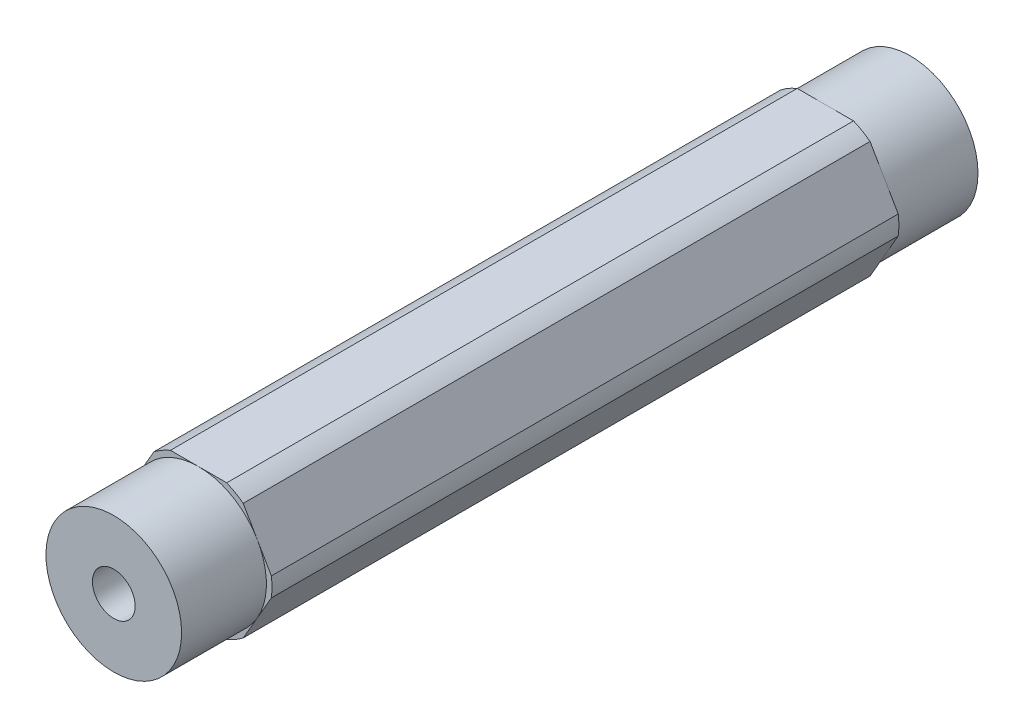
from build123d import *

# Parameters (mm, degrees)
SKETCH1_R           = 2.000000064
BOSS_EXTRUDE1_DEPTH = 29.34335
SKETCH4_R           = 6.35
SKETCH4_R_2         = 2.000000064
BOSS_EXTRUDE2_DEPTH = 7.9375


with BuildPart() as part:
    # Sketch1 → Boss-Extrude1 (new, symmetric)
    with BuildSketch(Plane.XY):
        with BuildLine():
            ThreePointArc((4.181770846, 5.456960429), (3.437499983, 5.953924622), (2.634980936, 6.35))
            Line((2.634980936, 6.35), (-2.634980936, 6.35))
            ThreePointArc((-2.634980936, 6.35), (-3.437499983, 5.953924622), (-4.181770846, 5.456960429))
            Line((-4.181770846, 5.456960429), (-6.816751782, 0.893039571))
            ThreePointArc((-6.816751782, 0.893039571), (-6.874999966, 0), (-6.816751782, -0.893039571))
            Line((-6.816751782, -0.893039571), (-4.181770846, -5.456960429))
            ThreePointArc((-4.181770846, -5.456960429), (-3.437499983, -5.953924622), (-2.634980936, -6.35))
            Line((-2.634980936, -6.35), (2.634980936, -6.35))
            ThreePointArc((2.634980936, -6.35), (3.437499983, -5.953924622), (4.181770846, -5.456960429))
            Line((4.181770846, -5.456960429), (6.816751782, -0.893039571))
            ThreePointArc((6.816751782, -0.893039571), (6.860422465, -0.447468582), (6.874999966, 0))
            ThreePointArc((6.874999966, 0), (6.860422465, 0.447468582), (6.816751782, 0.893039571))
            Line((6.816751782, 0.893039571), (4.181770846, 5.456960429))
        make_face()
        Circle(SKETCH1_R, mode=Mode.SUBTRACT)
    extrude(amount=BOSS_EXTRUDE1_DEPTH, both=True)

    # Sketch4 → Boss-Extrude2 (add)
    with BuildSketch(Plane.XY.offset(29.34335)):
        Circle(SKETCH4_R)
        Circle(SKETCH4_R_2, mode=Mode.SUBTRACT)
    boss_extrude2 = extrude(amount=BOSS_EXTRUDE2_DEPTH)

    # Mirror1: Boss-Extrude2 across plane
    add(boss_extrude2.mirror(Plane.XY))


solid = part.part
